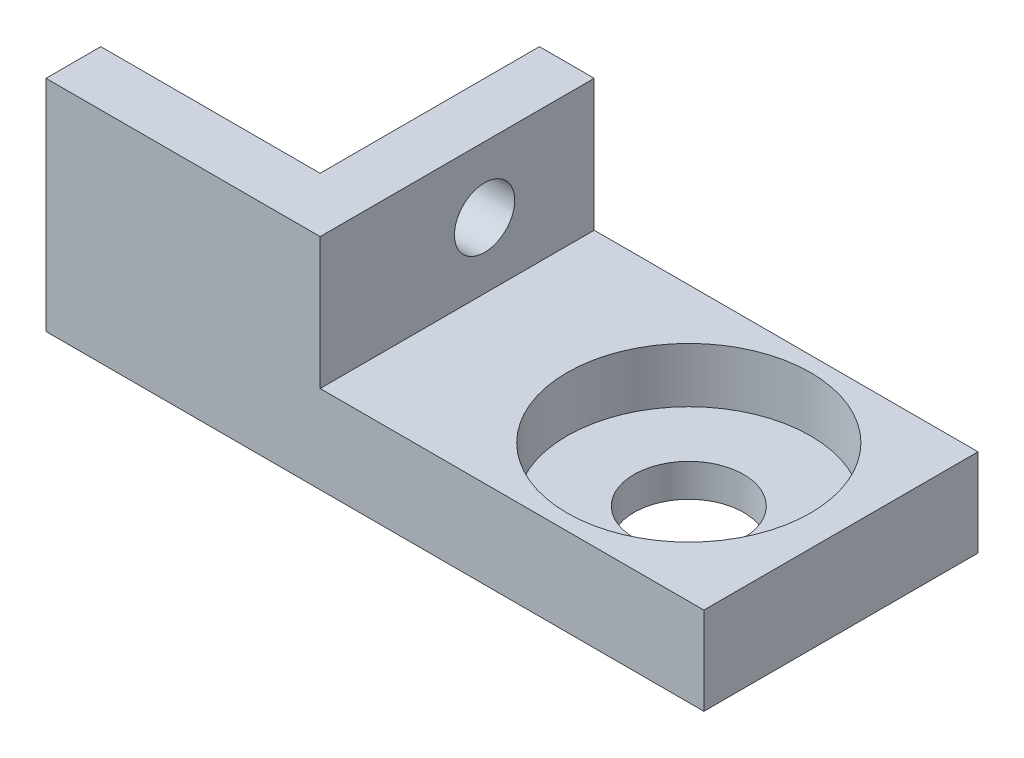
from build123d import *

# Parameters (mm, degrees)
BOSS_EXTRUDE1_DEPTH = 20
SKETCH2_W           = 35
SKETCH2_H           = 25
CUT_EXTRUDE1_DEPTH  = 12
SKETCH3_R           = 11.1
CUT_EXTRUDE2_DEPTH  = 5
SKETCH4_R           = 5
CUT_EXTRUDE3_DEPTH  = 68.186308129
SKETCH5_R           = 2.75
CUT_EXTRUDE4_DEPTH  = 48.434164903


with BuildPart() as part:
    # Sketch1 → Boss-Extrude1 (new body)
    with BuildSketch(Plane(origin=(0, 0, 0), x_dir=(1, 0, 0), z_dir=(0, 1, 0))):
        Polygon((0, 0), (60, 0), (60, 25), (20, 25), (20, 5), (0, 5), align=None)
    extrude(amount=BOSS_EXTRUDE1_DEPTH)

    # Sketch2 → Cut-Extrude1 (cut)
    with BuildSketch(Plane(origin=(0, 20, 0), x_dir=(1, 0, 0), z_dir=(0, 1, 0))):
        with Locations((42.5, 12.5)):
            Rectangle(SKETCH2_W, SKETCH2_H)
    extrude(amount=-CUT_EXTRUDE1_DEPTH, mode=Mode.SUBTRACT)

    # Sketch3 → Cut-Extrude2 (cut)
    with BuildSketch(Plane(origin=(0, 8, 0), x_dir=(1, 0, 0), z_dir=(0, 1, 0))):
        with Locations((46.1, 12.525762493)):
            Circle(SKETCH3_R)
    extrude(amount=-CUT_EXTRUDE2_DEPTH, mode=Mode.SUBTRACT)

    # Sketch4 → Cut-Extrude3 (cut, through all)
    with BuildSketch(Plane(origin=(0, 3, 0), x_dir=(1, 0, 0), z_dir=(0, 1, 0))):
        with Locations((46.1, 12.525762493)):
            Circle(SKETCH4_R)
    extrude(amount=-CUT_EXTRUDE3_DEPTH, mode=Mode.SUBTRACT)

    # Sketch5 → Cut-Extrude4 (cut, through all)
    with BuildSketch(Plane(origin=(25, 0, 0), x_dir=(0, 0, -1), z_dir=(1, 0, 0))):
        with Locations((15, 14)):
            Circle(SKETCH5_R)
    extrude(amount=-CUT_EXTRUDE4_DEPTH, mode=Mode.SUBTRACT)


solid = part.part
